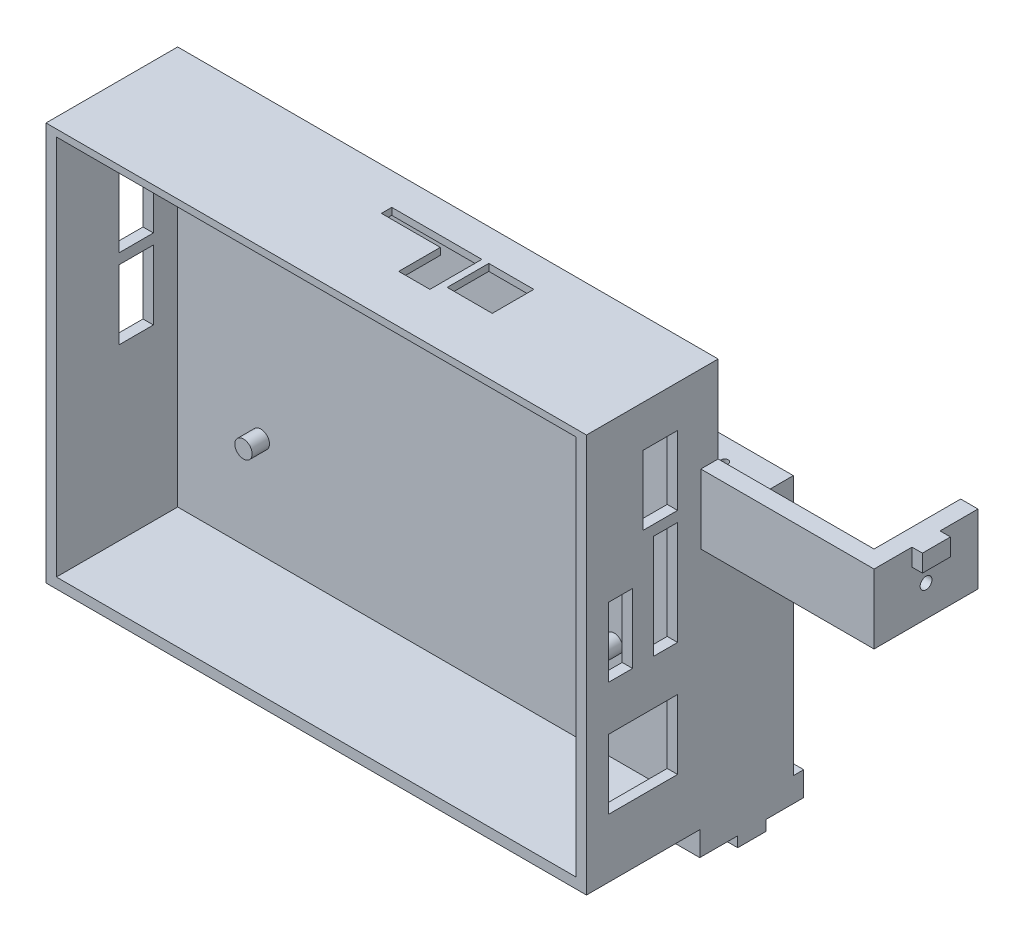
from build123d import *

# Parameters (mm, degrees)
SKETCH_1_W          = 150
SKETCH_1_H          = 110
EXTRUDE_1_DEPTH     = 3
SKETCH_3_R          = 2.5
EXTRUDE_2_DEPTH     = 5
SKETCH_4_W          = 156
SKETCH_4_H          = 115
SKETCH_4_W_2        = 150
SKETCH_4_H_2        = 110
EXTRUDE_3_DEPTH     = 3
SKETCH_4_2_W        = 156
SKETCH_4_2_H        = 115
SKETCH_4_2_W_2      = 150
SKETCH_4_2_H_2      = 110
EXTRUDE_4_DEPTH     = 35
SKETCH_7_R          = 3.5
EXTRUDE_5_DEPTH     = 20
SKETCH_8_W          = 135
SKETCH_8_H          = 75
SKETCH_8_W_2        = 129
SKETCH_8_H_2        = 69
EXTRUDE_6_DEPTH     = 21.7
SKETCH_9_R          = 1.25
EXTRUDE_7_DEPTH     = 1.7
CUT_EXTRUDE_1_REACH = 180.869
SKETCH_11_W         = 15
SKETCH_11_H         = 20
CUT_EXTRUDE_2_REACH = 197.205
SKETCH_12_W         = 10
SKETCH_12_H         = 20
CUT_EXTRUDE_6_REACH = 175.951
CUT_EXTRUDE_7_REACH = 196.574
SKETCH_13_W         = 13
SKETCH_13_H         = 12
CUT_EXTRUDE_8_REACH = 197.205
SKETCH_14_W         = 10
SKETCH_14_H         = 20
SKETCH_14_W_2       = 7
SKETCH_14_H_2       = 30
SKETCH_14_W_3       = 20
SKETCH_17_W         = 20
SKETCH_17_H         = 30
EXTRUDE_9_DEPTH     = 7
SKETCH_18_W         = 5
SKETCH_18_H         = 8.1
EXTRUDE_10_DEPTH    = 3
SKETCH_27_W         = 30
SKETCH_27_H         = 20
EXTRUDE_11_DEPTH    = 5
SKETCH_28_W         = 8.1
SKETCH_28_H         = 5
EXTRUDE_13_DEPTH    = 3
EXTRUDE_19_DEPTH    = 5


# Read off the part's stored shape, not the designer's step: 高级异型孔1, 高级异型孔3
with BuildPart() as part:
    # 草图1 → 凸台-拉伸1 (new body)
    with BuildSketch(Plane.XY):
        with Locations((75, 55)):
            Rectangle(SKETCH_1_W, SKETCH_1_H)
    extrude(amount=-EXTRUDE_1_DEPTH)

    # 草图3 → 凸台-拉伸2 (add)
    with BuildSketch(Plane.XY):
        with Locations((24, 105)):
            Circle(SKETCH_3_R)
        with Locations((126, 105)):
            Circle(SKETCH_3_R)
        with Locations((24, 29)):
            Circle(SKETCH_3_R)
        with Locations((126, 29)):
            Circle(SKETCH_3_R)
    extrude(amount=EXTRUDE_2_DEPTH)

    # 草图4 → 凸台-拉伸3 (add)
    with BuildSketch(Plane.XY):
        with Locations((75, 54.5)):
            Rectangle(SKETCH_4_W, SKETCH_4_H)
        with Locations((75, 55)):
            Rectangle(SKETCH_4_W_2, SKETCH_4_H_2, mode=Mode.SUBTRACT)
    extrude(amount=-EXTRUDE_3_DEPTH)

    # 草图4<2> → 凸台-拉伸4 (add)
    with BuildSketch(Plane.XY):
        with Locations((75, 54.5)):
            Rectangle(SKETCH_4_2_W, SKETCH_4_2_H)
        with Locations((75, 55)):
            Rectangle(SKETCH_4_2_W_2, SKETCH_4_2_H_2, mode=Mode.SUBTRACT)
    extrude(amount=EXTRUDE_4_DEPTH)

    # 草图7 → 凸台-拉伸5 (add)
    with BuildSketch(Plane(origin=(0, 0, -3), x_dir=(-1, 0, 0), z_dir=(0, 0, -1))):
        with Locations(Location((-144, 63, 0), (0, 0, 180))):
            Circle(SKETCH_7_R)
        with Locations(Location((-27, 63, 0), (0, 0, 180))):
            Circle(SKETCH_7_R)
        with Locations(Location((-27, 6, 0), (0, 0, 180))):
            Circle(SKETCH_7_R)
        with Locations(Location((-144, 6, 0), (0, 0, 180))):
            Circle(SKETCH_7_R)
        with Locations(Location((-42, 63, 0), (0, 0, 180))):
            Circle(SKETCH_7_R)
        with Locations(Location((-42, 6, 0), (0, 0, 180))):
            Circle(SKETCH_7_R)
    extrude(amount=EXTRUDE_5_DEPTH)

    # 草图8 → 凸台-拉伸6 (add)
    with BuildSketch(Plane(origin=(0, 0, -3), x_dir=(-1, 0, 0), z_dir=(0, 0, -1))):
        with Locations((-85.5, 34.5)):
            Rectangle(SKETCH_8_W, SKETCH_8_H)
        with Locations((-85.5, 34.5)):
            Rectangle(SKETCH_8_W_2, SKETCH_8_H_2, mode=Mode.SUBTRACT)
    extrude(amount=EXTRUDE_6_DEPTH)

    # 草图9 → 凸台-拉伸7 (add)
    with BuildSketch(Plane(origin=(0, 0, -23), x_dir=(-1, 0, 0), z_dir=(0, 0, -1))):
        with Locations((-144, 63)):
            Circle(SKETCH_9_R)
        with Locations((-42, 63)):
            Circle(SKETCH_9_R)
        with Locations((-27, 63)):
            Circle(SKETCH_9_R)
        with Locations((-27, 6)):
            Circle(SKETCH_9_R)
        with Locations((-42, 6)):
            Circle(SKETCH_9_R)
        with Locations((-144, 6)):
            Circle(SKETCH_9_R)
    extrude(amount=EXTRUDE_7_DEPTH)

    # 草图11 → 切除-拉伸1 (cut, up to next)
    with BuildSketch(Plane.ZY.offset(-18), mode=Mode.PRIVATE) as cut_extrude_1_sk1:
        with Locations((-10.5, 34.5)):
            Rectangle(SKETCH_11_W, SKETCH_11_H)
    cut_extrude_1_tool1 = extrude(cut_extrude_1_sk1.sketch, amount=-CUT_EXTRUDE_1_REACH, mode=Mode.PRIVATE) & part.part
    add(cut_extrude_1_tool1.solids().sort_by_distance((18, 34.5, -10.5))[0], mode=Mode.SUBTRACT)

    # 草图12 → 切除-拉伸2 (cut, up to next)
    with BuildSketch(Plane.ZY.offset(3), mode=Mode.PRIVATE) as cut_extrude_2_sk1:
        with Locations((12, 82)):
            Rectangle(SKETCH_12_W, SKETCH_12_H)
    cut_extrude_2_tool1 = extrude(cut_extrude_2_sk1.sketch, amount=-CUT_EXTRUDE_2_REACH, mode=Mode.PRIVATE) & part.part
    # 草图12 → 切除-拉伸2 (cut, up to next)
    with BuildSketch(Plane.ZY.offset(3), mode=Mode.PRIVATE) as cut_extrude_2_sk2:
        with Locations((12, 59)):
            Rectangle(SKETCH_12_W, SKETCH_12_H)
    cut_extrude_2_tool2 = extrude(cut_extrude_2_sk2.sketch, amount=-CUT_EXTRUDE_2_REACH, mode=Mode.PRIVATE) & part.part
    add(cut_extrude_2_tool1.solids().sort_by_distance((-3, 82, 12))[0], mode=Mode.SUBTRACT)
    add(cut_extrude_2_tool2.solids().sort_by_distance((-3, 59, 12))[0], mode=Mode.SUBTRACT)

    # 草图15 → 切除-拉伸6 (cut, up to next)
    with BuildSketch(Plane(origin=(0, 72, 0), x_dir=(1, 0, 0), z_dir=(0, 1, 0)), mode=Mode.PRIVATE) as cut_extrude_6_sk1:
        with BuildLine():
            Line((34.181280938, 18.265340741), (34.181280938, 8.265340741))
            ThreePointArc((34.181280938, 8.265340741), (33.181280938, 7.265340741), (32.181280938, 8.265340741))
            Line((32.181280938, 8.265340741), (32.181280938, 18.265340741))
            ThreePointArc((32.181280938, 18.265340741), (33.181280938, 19.265340741), (34.181280938, 18.265340741))
        make_face()
    cut_extrude_6_tool1 = extrude(cut_extrude_6_sk1.sketch, amount=-CUT_EXTRUDE_6_REACH, mode=Mode.PRIVATE) & part.part
    # 草图15 → 切除-拉伸6 (cut, up to next)
    with BuildSketch(Plane(origin=(0, 72, 0), x_dir=(1, 0, 0), z_dir=(0, 1, 0)), mode=Mode.PRIVATE) as cut_extrude_6_sk2:
        with BuildLine():
            Line((46.010960704, 18.265340741), (46.010960704, 8.265340741))
            ThreePointArc((46.010960704, 8.265340741), (45.010960704, 7.265340741), (44.010960704, 8.265340741))
            Line((44.010960704, 8.265340741), (44.010960704, 18.265340741))
            ThreePointArc((44.010960704, 18.265340741), (45.010960704, 19.265340741), (46.010960704, 18.265340741))
        make_face()
    cut_extrude_6_tool2 = extrude(cut_extrude_6_sk2.sketch, amount=-CUT_EXTRUDE_6_REACH, mode=Mode.PRIVATE) & part.part
    # 草图15 → 切除-拉伸6 (cut, up to next)
    with BuildSketch(Plane(origin=(0, 72, 0), x_dir=(1, 0, 0), z_dir=(0, 1, 0)), mode=Mode.PRIVATE) as cut_extrude_6_sk3:
        with BuildLine():
            Line((57.840640469, 18.265340741), (57.840640469, 8.265340741))
            ThreePointArc((57.840640469, 8.265340741), (56.840640469, 7.265340741), (55.840640469, 8.265340741))
            Line((55.840640469, 8.265340741), (55.840640469, 18.265340741))
            ThreePointArc((55.840640469, 18.265340741), (56.840640469, 19.265340741), (57.840640469, 18.265340741))
        make_face()
    cut_extrude_6_tool3 = extrude(cut_extrude_6_sk3.sketch, amount=-CUT_EXTRUDE_6_REACH, mode=Mode.PRIVATE) & part.part
    # 草图15 → 切除-拉伸6 (cut, up to next)
    with BuildSketch(Plane(origin=(0, 72, 0), x_dir=(1, 0, 0), z_dir=(0, 1, 0)), mode=Mode.PRIVATE) as cut_extrude_6_sk4:
        with BuildLine():
            Line((69.670320235, 18.265340741), (69.670320235, 8.265340741))
            ThreePointArc((69.670320235, 8.265340741), (68.670320235, 7.265340741), (67.670320235, 8.265340741))
            Line((67.670320235, 8.265340741), (67.670320235, 18.265340741))
            ThreePointArc((67.670320235, 18.265340741), (68.670320235, 19.265340741), (69.670320235, 18.265340741))
        make_face()
    cut_extrude_6_tool4 = extrude(cut_extrude_6_sk4.sketch, amount=-CUT_EXTRUDE_6_REACH, mode=Mode.PRIVATE) & part.part
    # 草图15 → 切除-拉伸6 (cut, up to next)
    with BuildSketch(Plane(origin=(0, 72, 0), x_dir=(1, 0, 0), z_dir=(0, 1, 0)), mode=Mode.PRIVATE) as cut_extrude_6_sk5:
        with BuildLine():
            Line((81.5, 18.265340741), (81.5, 8.265340741))
            ThreePointArc((81.5, 8.265340741), (80.5, 7.265340741), (79.5, 8.265340741))
            Line((79.5, 8.265340741), (79.5, 18.265340741))
            ThreePointArc((79.5, 18.265340741), (80.5, 19.265340741), (81.5, 18.265340741))
        make_face()
    cut_extrude_6_tool5 = extrude(cut_extrude_6_sk5.sketch, amount=-CUT_EXTRUDE_6_REACH, mode=Mode.PRIVATE) & part.part
    # 草图15 → 切除-拉伸6 (cut, up to next)
    with BuildSketch(Plane(origin=(0, 72, 0), x_dir=(1, 0, 0), z_dir=(0, 1, 0)), mode=Mode.PRIVATE) as cut_extrude_6_sk6:
        with BuildLine():
            Line((93.329679765, 18.265340741), (93.329679765, 8.265340741))
            ThreePointArc((93.329679765, 8.265340741), (92.329679765, 7.265340741), (91.329679765, 8.265340741))
            Line((91.329679765, 8.265340741), (91.329679765, 18.265340741))
            ThreePointArc((91.329679765, 18.265340741), (92.329679765, 19.265340741), (93.329679765, 18.265340741))
        make_face()
    cut_extrude_6_tool6 = extrude(cut_extrude_6_sk6.sketch, amount=-CUT_EXTRUDE_6_REACH, mode=Mode.PRIVATE) & part.part
    # 草图15 → 切除-拉伸6 (cut, up to next)
    with BuildSketch(Plane(origin=(0, 72, 0), x_dir=(1, 0, 0), z_dir=(0, 1, 0)), mode=Mode.PRIVATE) as cut_extrude_6_sk7:
        with BuildLine():
            Line((105.159359531, 18.265340741), (105.159359531, 8.265340741))
            ThreePointArc((105.159359531, 8.265340741), (104.159359531, 7.265340741), (103.159359531, 8.265340741))
            Line((103.159359531, 8.265340741), (103.159359531, 18.265340741))
            ThreePointArc((103.159359531, 18.265340741), (104.159359531, 19.265340741), (105.159359531, 18.265340741))
        make_face()
    cut_extrude_6_tool7 = extrude(cut_extrude_6_sk7.sketch, amount=-CUT_EXTRUDE_6_REACH, mode=Mode.PRIVATE) & part.part
    # 草图15 → 切除-拉伸6 (cut, up to next)
    with BuildSketch(Plane(origin=(0, 72, 0), x_dir=(1, 0, 0), z_dir=(0, 1, 0)), mode=Mode.PRIVATE) as cut_extrude_6_sk8:
        with BuildLine():
            Line((116.989039296, 18.265340741), (116.989039296, 8.265340741))
            ThreePointArc((116.989039296, 8.265340741), (115.989039296, 7.265340741), (114.989039296, 8.265340741))
            Line((114.989039296, 8.265340741), (114.989039296, 18.265340741))
            ThreePointArc((114.989039296, 18.265340741), (115.989039296, 19.265340741), (116.989039296, 18.265340741))
        make_face()
    cut_extrude_6_tool8 = extrude(cut_extrude_6_sk8.sketch, amount=-CUT_EXTRUDE_6_REACH, mode=Mode.PRIVATE) & part.part
    # 草图15 → 切除-拉伸6 (cut, up to next)
    with BuildSketch(Plane(origin=(0, 72, 0), x_dir=(1, 0, 0), z_dir=(0, 1, 0)), mode=Mode.PRIVATE) as cut_extrude_6_sk9:
        with BuildLine():
            Line((128.818719062, 18.265340741), (128.818719062, 8.265340741))
            ThreePointArc((128.818719062, 8.265340741), (127.818719062, 7.265340741), (126.818719062, 8.265340741))
            Line((126.818719062, 8.265340741), (126.818719062, 18.265340741))
            ThreePointArc((126.818719062, 18.265340741), (127.818719062, 19.265340741), (128.818719062, 18.265340741))
        make_face()
    cut_extrude_6_tool9 = extrude(cut_extrude_6_sk9.sketch, amount=-CUT_EXTRUDE_6_REACH, mode=Mode.PRIVATE) & part.part
    # 草图15 → 切除-拉伸6 (cut, up to next)
    with BuildSketch(Plane(origin=(0, 72, 0), x_dir=(1, 0, 0), z_dir=(0, 1, 0)), mode=Mode.PRIVATE) as cut_extrude_6_sk10:
        with BuildLine():
            Line((140.648398827, 18.265340741), (140.648398827, 8.265340741))
            ThreePointArc((140.648398827, 8.265340741), (139.648398827, 7.265340741), (138.648398827, 8.265340741))
            Line((138.648398827, 8.265340741), (138.648398827, 18.265340741))
            ThreePointArc((138.648398827, 18.265340741), (139.648398827, 19.265340741), (140.648398827, 18.265340741))
        make_face()
    cut_extrude_6_tool10 = extrude(cut_extrude_6_sk10.sketch, amount=-CUT_EXTRUDE_6_REACH, mode=Mode.PRIVATE) & part.part
    add(cut_extrude_6_tool1.solids().sort_by_distance((33.181281, 72, -13.265341))[0], mode=Mode.SUBTRACT)
    add(cut_extrude_6_tool2.solids().sort_by_distance((45.010961, 72, -13.265341))[0], mode=Mode.SUBTRACT)
    add(cut_extrude_6_tool3.solids().sort_by_distance((56.84064, 72, -13.265341))[0], mode=Mode.SUBTRACT)
    add(cut_extrude_6_tool4.solids().sort_by_distance((68.67032, 72, -13.265341))[0], mode=Mode.SUBTRACT)
    add(cut_extrude_6_tool5.solids().sort_by_distance((80.5, 72, -13.265341))[0], mode=Mode.SUBTRACT)
    add(cut_extrude_6_tool6.solids().sort_by_distance((92.32968, 72, -13.265341))[0], mode=Mode.SUBTRACT)
    add(cut_extrude_6_tool7.solids().sort_by_distance((104.15936, 72, -13.265341))[0], mode=Mode.SUBTRACT)
    add(cut_extrude_6_tool8.solids().sort_by_distance((115.989039, 72, -13.265341))[0], mode=Mode.SUBTRACT)
    add(cut_extrude_6_tool9.solids().sort_by_distance((127.818719, 72, -13.265341))[0], mode=Mode.SUBTRACT)
    add(cut_extrude_6_tool10.solids().sort_by_distance((139.648399, 72, -13.265341))[0], mode=Mode.SUBTRACT)

    # 草图13 → 切除-拉伸7 (cut, up to next)
    with BuildSketch(Plane(origin=(0, 112, 0), x_dir=(1, 0, 0), z_dir=(0, 1, 0)), mode=Mode.PRIVATE) as cut_extrude_7_sk1:
        with Locations((102.5, -12.2)):
            Rectangle(SKETCH_13_W, SKETCH_13_H)
    cut_extrude_7_tool1 = extrude(cut_extrude_7_sk1.sketch, amount=-CUT_EXTRUDE_7_REACH, mode=Mode.PRIVATE) & part.part
    # 草图13 → 切除-拉伸7 (cut, up to next)
    with BuildSketch(Plane(origin=(0, 112, 0), x_dir=(1, 0, 0), z_dir=(0, 1, 0)), mode=Mode.PRIVATE) as cut_extrude_7_sk2:
        Polygon((85, -9.2), (85, -21.2), (94, -21.2), (94, -6.2), (85, -6.2), (68, -6.2), (68, -9.2), align=None)
    cut_extrude_7_tool2 = extrude(cut_extrude_7_sk2.sketch, amount=-CUT_EXTRUDE_7_REACH, mode=Mode.PRIVATE) & part.part
    add(cut_extrude_7_tool1.solids().sort_by_distance((102.5, 112, 12.2))[0], mode=Mode.SUBTRACT)
    add(cut_extrude_7_tool2.solids().sort_by_distance((85.935484, 112, 12.054839))[0], mode=Mode.SUBTRACT)

    # 草图14 → 切除-拉伸8 (cut, up to next)
    with BuildSketch(Plane(origin=(153, 0, 0), x_dir=(0, 0, -1), z_dir=(1, 0, 0)), mode=Mode.PRIVATE) as cut_extrude_8_sk1:
        with Locations((-13.7, 90)):
            Rectangle(SKETCH_14_W, SKETCH_14_H)
    cut_extrude_8_tool1 = extrude(cut_extrude_8_sk1.sketch, amount=-CUT_EXTRUDE_8_REACH, mode=Mode.PRIVATE) & part.part
    # 草图14 → 切除-拉伸8 (cut, up to next)
    with BuildSketch(Plane(origin=(153, 0, 0), x_dir=(0, 0, -1), z_dir=(1, 0, 0)), mode=Mode.PRIVATE) as cut_extrude_8_sk2:
        with Locations((-12.2, 62)):
            Rectangle(SKETCH_14_W_2, SKETCH_14_H_2)
    cut_extrude_8_tool2 = extrude(cut_extrude_8_sk2.sketch, amount=-CUT_EXTRUDE_8_REACH, mode=Mode.PRIVATE) & part.part
    # 草图14 → 切除-拉伸8 (cut, up to next)
    with BuildSketch(Plane(origin=(153, 0, 0), x_dir=(0, 0, -1), z_dir=(1, 0, 0)), mode=Mode.PRIVATE) as cut_extrude_8_sk3:
        with Locations((-18.7, 24)):
            Rectangle(SKETCH_14_W_3, SKETCH_14_H)
    cut_extrude_8_tool3 = extrude(cut_extrude_8_sk3.sketch, amount=-CUT_EXTRUDE_8_REACH, mode=Mode.PRIVATE) & part.part
    # 草图14 → 切除-拉伸8 (cut, up to next)
    with BuildSketch(Plane(origin=(153, 0, 0), x_dir=(0, 0, -1), z_dir=(1, 0, 0)), mode=Mode.PRIVATE) as cut_extrude_8_sk4:
        with Locations((-25.2, 57)):
            Rectangle(SKETCH_14_W_2, SKETCH_14_H)
    cut_extrude_8_tool4 = extrude(cut_extrude_8_sk4.sketch, amount=-CUT_EXTRUDE_8_REACH, mode=Mode.PRIVATE) & part.part
    add(cut_extrude_8_tool1.solids().sort_by_distance((153, 90, 13.7))[0], mode=Mode.SUBTRACT)
    add(cut_extrude_8_tool2.solids().sort_by_distance((153, 62, 12.2))[0], mode=Mode.SUBTRACT)
    add(cut_extrude_8_tool3.solids().sort_by_distance((153, 24, 18.7))[0], mode=Mode.SUBTRACT)
    add(cut_extrude_8_tool4.solids().sort_by_distance((153, 57, 25.2))[0], mode=Mode.SUBTRACT)

    # 草图17 → 凸台-拉伸9 (add)
    with BuildSketch(Plane.XZ.offset(3)):
        with Locations((28, -12.7)):
            Rectangle(SKETCH_17_W, SKETCH_17_H)
        with Locations((143, -12.7)):
            Rectangle(SKETCH_17_W, SKETCH_17_H)
    extrude(amount=EXTRUDE_9_DEPTH)

    # 草图18 → 凸台-拉伸10 (add)
    with BuildSketch(Plane.XZ.offset(10)):
        with Locations((20.5, -12.7)):
            Rectangle(SKETCH_18_W, SKETCH_18_H)
        with Locations((150.5, -12.7)):
            Rectangle(SKETCH_18_W, SKETCH_18_H)
    extrude(amount=EXTRUDE_10_DEPTH)

    # 高级异型孔1 outline → 高级异型孔1 (revolve, cut)
    with BuildSketch(Plane(origin=(139, 0, -12.7), x_dir=(1, 0, 0), z_dir=(0, 0, 1))):
        Polygon((3.15, 0), (0, 0), (0, -10), (1.7, -10), (1.7, -1.45), align=None)
    revolve(axis=Axis((139, 0, -12.7), (0, 1, 0)), mode=Mode.SUBTRACT)

    # Other 1 2 outline → Other 1 2 (revolve, cut)
    with BuildSketch(Plane(origin=(32, 0, -12.7), x_dir=(1, 0, 0), z_dir=(0, 0, 1))):
        Polygon((3.15, 0), (0, 0), (0, -10), (1.7, -10), (1.7, -1.45), align=None)
    revolve(axis=Axis((32, 0, -12.7), (0, 1, 0)), mode=Mode.SUBTRACT)

    # 扫描2: sweep along a path in 草图26
    with BuildLine(Plane(origin=(0, 72, 0), x_dir=(1, 0, 0), z_dir=(0, 1, 0))) as sweep_2_path:
        Line((153, -2.3), (203, -2.3))
    # 草图24 → 扫描2 (sweep)
    with BuildSketch(Plane(origin=(153, 0, 0), x_dir=(0, 0, -1), z_dir=(1, 0, 0))):
        Polygon((3, 72), (18, 72), (18, 67), (-2, 67), (-2, 87), (3, 87), align=None)
    sweep(path=sweep_2_path.line)

    # 草图27 → 凸台-拉伸11 (add)
    with BuildSketch(Plane(origin=(203, 0, 0), x_dir=(0, 0, -1), z_dir=(1, 0, 0))):
        with Locations((13, 77)):
            Rectangle(SKETCH_27_W, SKETCH_27_H)
    extrude(amount=-EXTRUDE_11_DEPTH)

    # 草图28 → 凸台-拉伸13 (add)
    with BuildSketch(Plane(origin=(203, 0, 0), x_dir=(0, 0, -1), z_dir=(1, 0, 0))):
        with Locations((13, 84.5)):
            Rectangle(SKETCH_28_W, SKETCH_28_H)
    extrude(amount=EXTRUDE_13_DEPTH)

    # 草图35 → 凸台-拉伸19 (add)
    with BuildSketch(Plane.ZY.offset(-198)):
        with BuildLine():
            Line((-17, 76), (-17, 72))
            Line((-17, 72), (-9, 72))
            Line((-9, 72), (-9, 76))
            ThreePointArc((-9, 76), (-13, 80), (-17, 76))
        make_face()
    extrude(amount=EXTRUDE_19_DEPTH)

    # 高级异型孔3 outline → 高级异型孔3 (revolve, cut)
    with BuildSketch(Plane(origin=(0, 76, -13), x_dir=(0, 1, 0), z_dir=(0, 0, -1))):
        Polygon((0, 193), (3.15, 193), (1.7, 194.45), (1.7, 203), (0, 203), align=None)
    revolve(axis=Axis((0, 76, -13), (1, 0, 0)), mode=Mode.SUBTRACT)


solid = part.part
